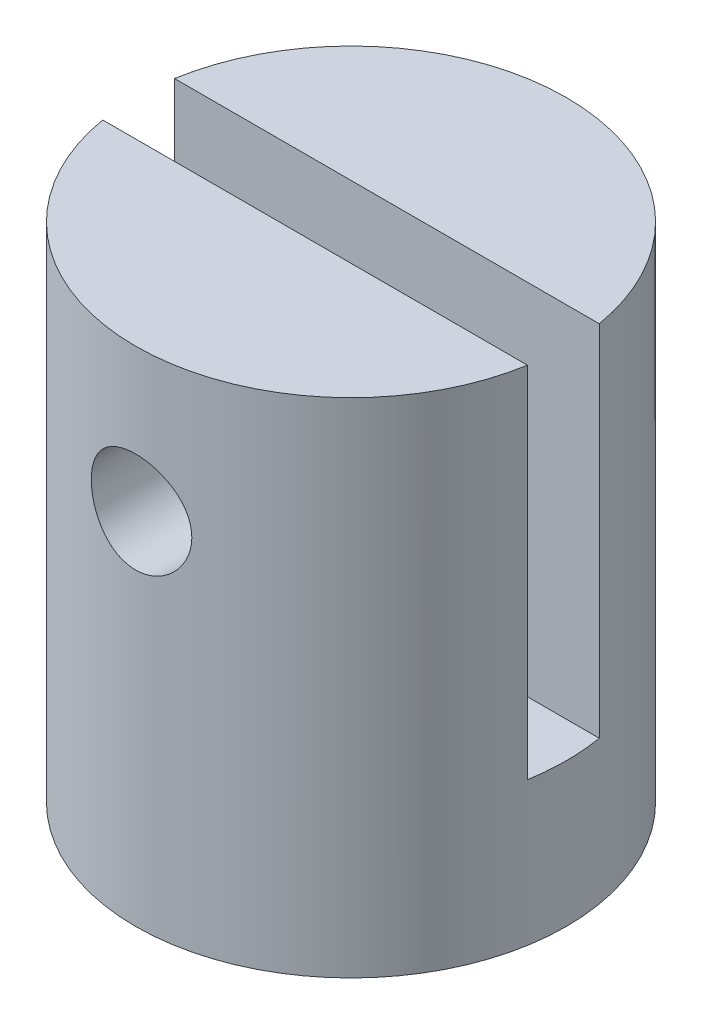
from build123d import *

# Parameters (mm, degrees)
SKETCH1_W               = 15
SKETCH1_H               = 35
SKETCH2_R               = 5
BOSS_EXTRUDE2_DEPTH     = 5
SKETCH4_W               = 30
SKETCH4_H               = 25
CUT_EXTRUDE1_DEPTH      = 2.5
CUT_EXTRUDE2_DEPTH      = 31.923292192
CUT_EXTRUDE2_DEPTH_BACK = 31.923292192
SKETCH5_R               = 3.5


with BuildPart() as part:
    # Sketch1 → Revolve1 (revolve)
    with BuildSketch(Plane.XY):
        with Locations((7.5, 0)):
            Rectangle(SKETCH1_W, SKETCH1_H)
    revolve(axis=Axis((0, -17.5, 0), (0, 1, 0)))

    # Sketch2 → Boss-Extrude2 (add)
    with BuildSketch(Plane.XZ.offset(17.5)):
        Circle(SKETCH2_R)
    extrude(amount=BOSS_EXTRUDE2_DEPTH)

    # Sketch4 → Cut-Extrude1 (cut, symmetric)
    with BuildSketch(Plane.XY):
        with Locations((0, 5)):
            Rectangle(SKETCH4_W, SKETCH4_H)
    extrude(amount=CUT_EXTRUDE1_DEPTH, both=True, mode=Mode.SUBTRACT)

    # Sketch5 → Cut-Extrude2 (cut, two sides: drawn at the far end of the back side and taken through both)
    with BuildSketch(Plane.XY.offset(-CUT_EXTRUDE2_DEPTH_BACK)):
        with Locations((0, 7.5)):
            Circle(SKETCH5_R)
    extrude(amount=CUT_EXTRUDE2_DEPTH + CUT_EXTRUDE2_DEPTH_BACK, mode=Mode.SUBTRACT)


solid = part.part
